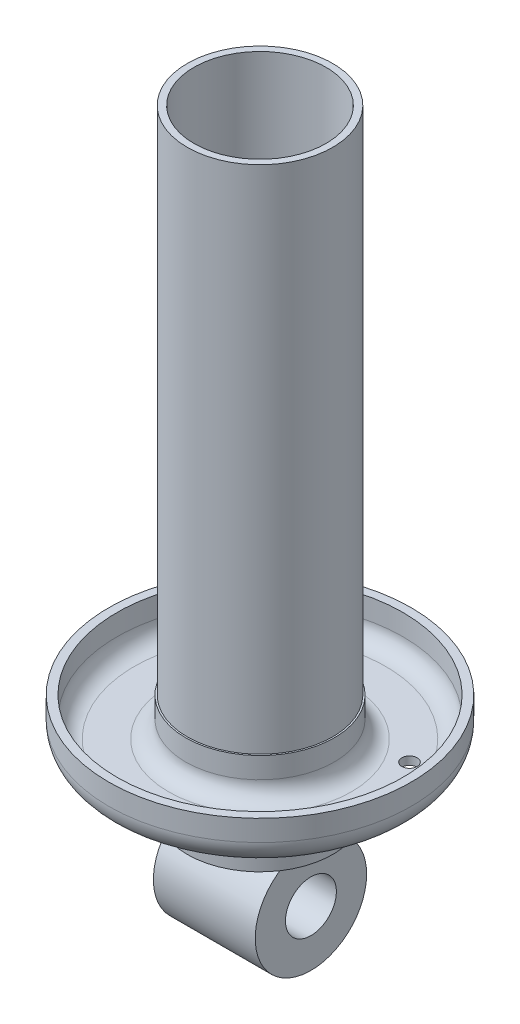
from build123d import *

# Parameters (mm, degrees)
SKETCH1_R           = 47.5
BOSS_EXTRUDE2_DEPTH = 14.6
SKETCH4_R           = 22.85
BOSS_EXTRUDE3_DEPTH = 10.4
SKETCH5_R           = 20.75
CUT_EXTRUDE3_DEPTH  = 72.676355934
FILLET2_R           = 8
FILLET3_R           = 8
SKETCH6_R           = 2.4
CUT_EXTRUDE4_DEPTH  = 72.676355934
CIRPATTERN1_COUNT   = 3
SKETCH7_R           = 22.85
SKETCH7_R_2         = 20.75
BOSS_EXTRUDE4_DEPTH = 150
BOSS_EXTRUDE5_START = -32
SKETCH4_2_R         = 22.85
BOSS_EXTRUDE5_DEPTH = 32
SKETCH8_R           = 17.5
SKETCH8_R_2         = 8
BOSS_EXTRUDE6_DEPTH = 16


# Read off the part's stored shape, not the designer's step: Shell2
with BuildPart() as part:
    # Sketch1 → Boss-Extrude2 (new body)
    with BuildSketch(Plane(origin=(0, 0, 0), x_dir=(1, 0, 0), z_dir=(0, 1, 0))):
        with Locations(Location((0, 0, 0), (0, 0, 270))):
            Circle(SKETCH1_R)
    extrude(amount=BOSS_EXTRUDE2_DEPTH)

    # Sketch4 → Boss-Extrude3 (add)
    with BuildSketch(Plane(origin=(0, 14.6, 0), x_dir=(1, 0, 0), z_dir=(0, 1, 0))):
        with Locations(Location((0, 0, 0), (0, 0, 270))):
            Circle(SKETCH4_R)
    extrude(amount=BOSS_EXTRUDE3_DEPTH)

    # Sketch5 → Cut-Extrude3 (cut, through all)
    with BuildSketch(Plane(origin=(0, 25, 0), x_dir=(1, 0, 0), z_dir=(0, 1, 0))):
        with Locations(Location((0, 0, 0), (0, 0, 270))):
            Circle(SKETCH5_R)
    extrude(amount=-CUT_EXTRUDE3_DEPTH, mode=Mode.SUBTRACT)

    # Fillet2
    fillet2_edges = [part.edges().sort_by_distance(p)[0] for p in [
        (0, 0, -47.5),
    ]]
    fillet(fillet2_edges, radius=FILLET2_R)

    # Fillet3
    fillet3_edges = [part.edges().sort_by_distance(p)[0] for p in [
        (0, 0, -20.75),
    ]]
    fillet(fillet3_edges, radius=FILLET3_R)

    # Shell2 outline → Shell2 (revolve, cut)
    with BuildSketch(Plane.XY):
        with BuildLine():
            Line((44.9, 8), (44.9, 14.6))
            Line((44.9, 14.6), (23.35, 14.6))
            Line((23.35, 14.6), (23.35, 8))
            ThreePointArc((23.35, 8), (24.931623382, 4.181623382), (28.75, 2.6))
            Line((28.75, 2.6), (39.5, 2.6))
            ThreePointArc((39.5, 2.6), (43.318376618, 4.181623382), (44.9, 8))
        make_face()
    revolve(axis=Axis((0, 0, 0), (0, 1, 0)), mode=Mode.SUBTRACT)

    # Sketch6 → Cut-Extrude4 (cut, through all)
    with BuildSketch(Plane(origin=(0, 0, 0), x_dir=(-1, 0, 0), z_dir=(0, -1, 0))):
        with Locations(Location((0, -34.384260124, 0), (0, 0, 90))):
            Circle(SKETCH6_R)
    cut_extrude4 = extrude(amount=-CUT_EXTRUDE4_DEPTH, mode=Mode.SUBTRACT)

    # CirPattern1: Cut-Extrude4 ×3 about axis
    cirpattern1_axis = Axis((0, 0, 0), (0, 1, 0))
    for i in range(1, CIRPATTERN1_COUNT):
        add(cut_extrude4.rotate(cirpattern1_axis, i * 360 / CIRPATTERN1_COUNT), mode=Mode.SUBTRACT)

    # Sketch7 → Boss-Extrude4 (add)
    with BuildSketch(Plane(origin=(0, 25, 0), x_dir=(1, 0, 0), z_dir=(0, 1, 0))):
        with Locations(Location((0, 0, 0), (0, 0, 270))):
            Circle(SKETCH7_R)
        with Locations(Location((0, 0, 0), (0, 0, 270))):
            Circle(SKETCH7_R_2, mode=Mode.SUBTRACT)
    extrude(amount=BOSS_EXTRUDE4_DEPTH)

    # Sketch4<2> → Boss-Extrude5 (add)
    with BuildSketch(Plane(origin=(0, 14.6, 0), x_dir=(1, 0, 0), z_dir=(0, 1, 0)).offset(BOSS_EXTRUDE5_START)):
        with Locations(Location((0, 0, 0), (0, 0, 270))):
            Circle(SKETCH4_2_R)
    extrude(amount=BOSS_EXTRUDE5_DEPTH)


with BuildPart() as body_2:
    # Sketch8 → Boss-Extrude6 (new, symmetric)
    with BuildSketch(Plane(origin=(0, 0, 0), x_dir=(0, 0, -1), z_dir=(1, 0, 0))):
        with Locations((0, -34.9)):
            Circle(SKETCH8_R)
        with Locations((0, -34.9)):
            Circle(SKETCH8_R_2, mode=Mode.SUBTRACT)
    extrude(amount=BOSS_EXTRUDE6_DEPTH, both=True)


solid = Compound([part.part, body_2.part])
